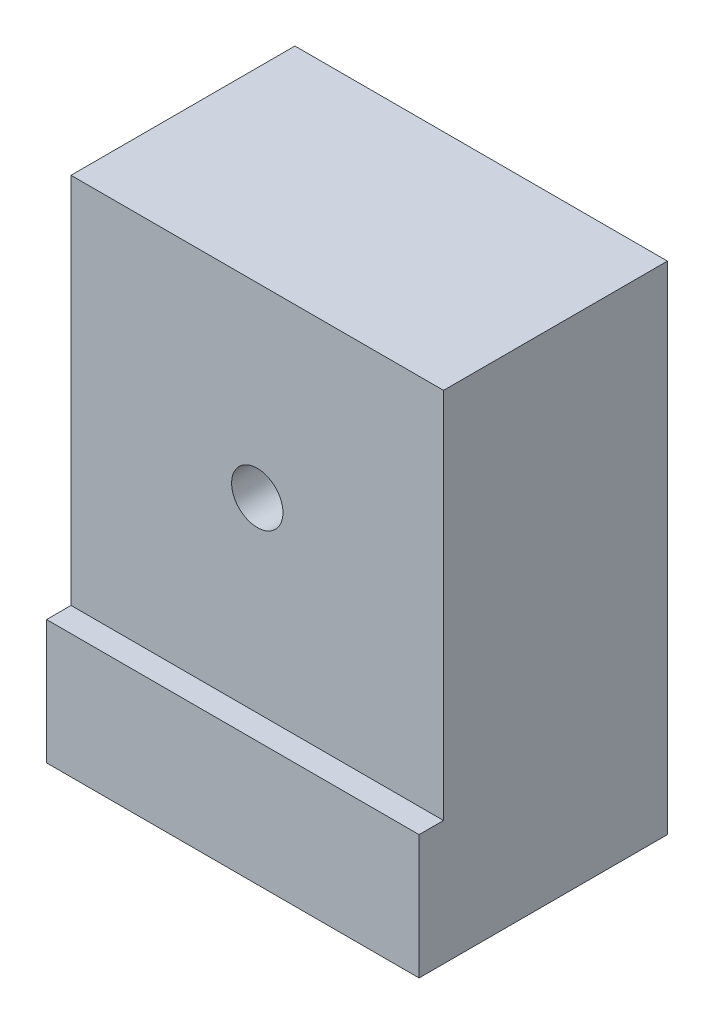
from build123d import *

# Parameters (mm, degrees)
SKETCH1_W           = 76.2
SKETCH1_H           = 50.8
BOSS_EXTRUDE1_DEPTH = 101.6
SKETCH2_R           = 5.25
CUT_EXTRUDE1_DEPTH  = 300
SKETCH3_W           = 76.2
SKETCH3_H           = 76.2
CUT_EXTRUDE2_DEPTH  = 5


with BuildPart() as part:
    # Sketch1 → Boss-Extrude1 (new body)
    with BuildSketch(Plane(origin=(0, 0, 0), x_dir=(1, 0, 0), z_dir=(0, 1, 0))):
        with Locations((38.1, 25.4)):
            Rectangle(SKETCH1_W, SKETCH1_H)
    extrude(amount=BOSS_EXTRUDE1_DEPTH)

    # Sketch2 → Cut-Extrude1 (cut)
    with BuildSketch(Plane.XY):
        with Locations((38.1, 63.5)):
            Circle(SKETCH2_R)
    extrude(amount=-CUT_EXTRUDE1_DEPTH, mode=Mode.SUBTRACT)

    # Sketch3 → Cut-Extrude2 (cut)
    with BuildSketch(Plane.XY):
        with Locations((38.1, 63.5)):
            Rectangle(SKETCH3_W, SKETCH3_H)
    extrude(amount=-CUT_EXTRUDE2_DEPTH, mode=Mode.SUBTRACT)


solid = part.part
